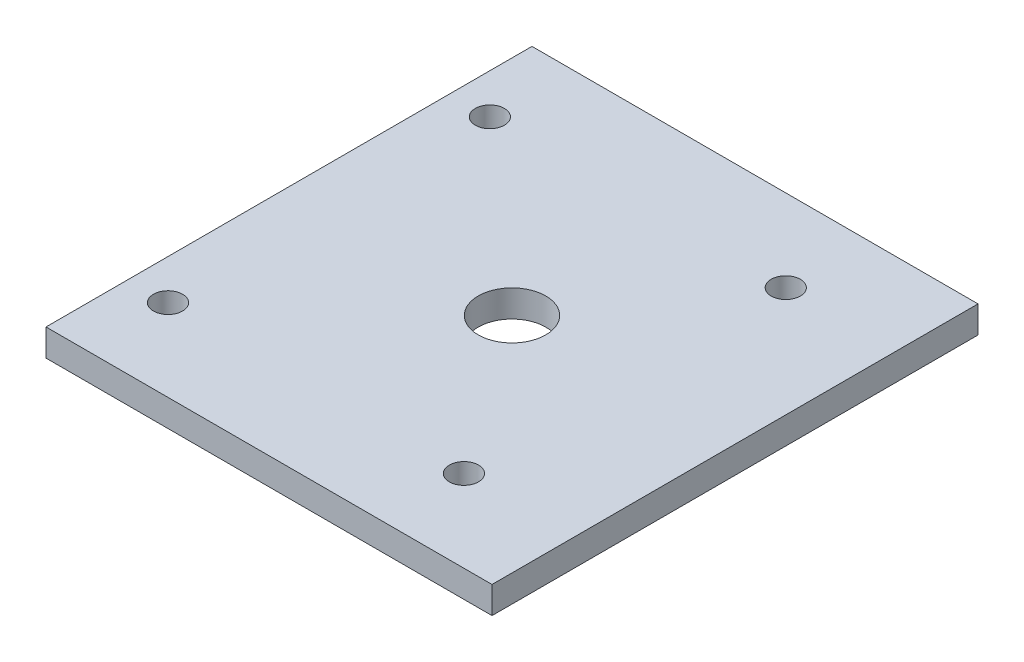
from build123d import *

# Parameters (mm, degrees)
SKETCH1_W           = 104.902
SKETCH1_H           = 114.3
BOSS_EXTRUDE1_DEPTH = 6.35
CUT_EXTRUDE2_REACH  = 79.83
SKETCH3_R           = 3.429
CUT_EXTRUDE3_REACH  = 79.83
SKETCH4_R           = 7.9375


with BuildPart() as part:
    # Sketch1 → Boss-Extrude1 (new body)
    with BuildSketch(Plane(origin=(0, 0, 0), x_dir=(1, 0, 0), z_dir=(0, 1, 0))):
        Rectangle(SKETCH1_W, SKETCH1_H)
    extrude(amount=BOSS_EXTRUDE1_DEPTH)

    # Sketch3 → Cut-Extrude2 (cut, up to next)
    with BuildSketch(Plane.XZ, mode=Mode.PRIVATE) as cut_extrude2_sk1:
        with Locations((-43.053, 37.846)):
            Circle(SKETCH3_R)
    cut_extrude2_tool1 = extrude(cut_extrude2_sk1.sketch, amount=-CUT_EXTRUDE2_REACH, mode=Mode.PRIVATE) & part.part
    # Sketch3 → Cut-Extrude2 (cut, up to next)
    with BuildSketch(Plane.XZ, mode=Mode.PRIVATE) as cut_extrude2_sk2:
        with Locations((-43.053, -37.846)):
            Circle(SKETCH3_R)
    cut_extrude2_tool2 = extrude(cut_extrude2_sk2.sketch, amount=-CUT_EXTRUDE2_REACH, mode=Mode.PRIVATE) & part.part
    # Sketch3 → Cut-Extrude2 (cut, up to next)
    with BuildSketch(Plane.XZ, mode=Mode.PRIVATE) as cut_extrude2_sk3:
        with Locations((26.543, 37.846)):
            Circle(SKETCH3_R)
    cut_extrude2_tool3 = extrude(cut_extrude2_sk3.sketch, amount=-CUT_EXTRUDE2_REACH, mode=Mode.PRIVATE) & part.part
    # Sketch3 → Cut-Extrude2 (cut, up to next)
    with BuildSketch(Plane.XZ, mode=Mode.PRIVATE) as cut_extrude2_sk4:
        with Locations((26.543, -37.846)):
            Circle(SKETCH3_R)
    cut_extrude2_tool4 = extrude(cut_extrude2_sk4.sketch, amount=-CUT_EXTRUDE2_REACH, mode=Mode.PRIVATE) & part.part
    add(cut_extrude2_tool1.solids().sort_by_distance((-43.053, 0, 37.846))[0], mode=Mode.SUBTRACT)
    add(cut_extrude2_tool2.solids().sort_by_distance((-43.053, 0, -37.846))[0], mode=Mode.SUBTRACT)
    add(cut_extrude2_tool3.solids().sort_by_distance((26.543, 0, 37.846))[0], mode=Mode.SUBTRACT)
    add(cut_extrude2_tool4.solids().sort_by_distance((26.543, 0, -37.846))[0], mode=Mode.SUBTRACT)

    # Sketch4 → Cut-Extrude3 (cut, up to next)
    with BuildSketch(Plane.XZ, mode=Mode.PRIVATE) as cut_extrude3_sk1:
        Circle(SKETCH4_R)
    cut_extrude3_tool1 = extrude(cut_extrude3_sk1.sketch, amount=-CUT_EXTRUDE3_REACH, mode=Mode.PRIVATE) & part.part
    add(cut_extrude3_tool1.solids().sort_by_distance((0, 0, 0))[0], mode=Mode.SUBTRACT)


solid = part.part
